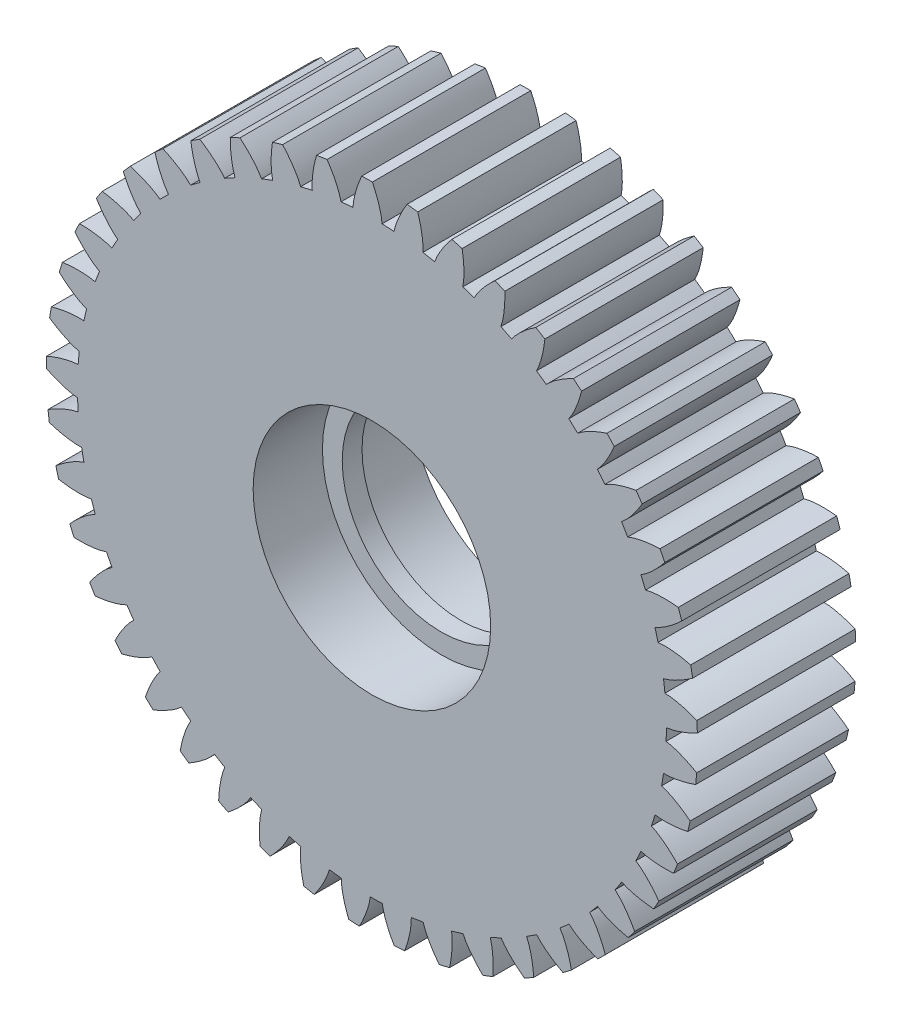
from build123d import *

# Parameters (mm, degrees)
SKETCH1_R           = 16.45
BOSS_EXTRUDE1_DEPTH = 4
CUT_EXTRUDE1_DEPTH  = 24.605190107
CIRPATTERN2_COUNT   = 45
SKETCH3_R           = 6
CUT_EXTRUDE2_DEPTH  = 3.5
SKETCH4_R           = 5
CUT_EXTRUDE3_DEPTH  = 24.694965986


with BuildPart() as part:
    # Sketch1 → Boss-Extrude1 (new, symmetric)
    with BuildSketch(Plane.XY):
        Circle(SKETCH1_R)
    extrude(amount=BOSS_EXTRUDE1_DEPTH, both=True)

    # Sketch2 → Cut-Extrude1 (cut, symmetric)
    with BuildSketch(Plane.XY):
        with BuildLine():
            ThreePointArc((14.874999148, 0.005033376), (14.874999787, 0.002516688), (14.875, 0))
            ThreePointArc((14.875, 0), (14.872024444, -0.297512903), (14.863098968, -0.594906779))
            ThreePointArc((14.863098968, -0.594906779), (14.862998103, -0.597421445), (14.862896813, -0.599936094))
            add(Edge.make_bspline(
                [(14.862896813, -0.599936094), (14.870907538, -0.601068862), (14.895736459, -0.604763281), (14.937417723, -0.611844995), (15.004055833, -0.624994787), (15.087462709, -0.644243252), (15.178684548, -0.66823395), (15.277399962, -0.697384976), (15.375371502, -0.729155348), (15.47258681, -0.76333931), (15.56893702, -0.799632819), (15.685024278, -0.846230906), (15.823329346, -0.905762447), (15.98357076, -0.980633134), (16.156460134, -1.068169193), (16.285563182, -1.138667745), (16.368038757, -1.185527975), (16.405637502, -1.207293734)],
                knots=[0.019933852, 0.019933852, 0.019933852, 0.019933852, 0.019933852, 0.02853182, 0.04661014, 0.064854849, 0.092110525, 0.119476176, 0.146842496, 0.174208854, 0.201574956, 0.228941013, 0.256307345, 0.307035032, 0.361767352, 0.416499661, 0.46276345, 0.46276345, 0.46276345, 0.46276345, 0.46276345], degree=4))
            ThreePointArc((16.405637502, -1.207293734), (16.438905634, -0.604054259), (16.45, 0))
            ThreePointArc((16.45, 0), (16.447698848, 0.275141053), (16.440796037, 0.550205128))
            add(Edge.make_bspline(
                [(14.874999148, 0.005033376), (14.883048768, 0.005844859), (14.908005577, 0.008543321), (14.949936717, 0.01395238), (15.017047422, 0.024426544), (15.101157385, 0.040323856), (15.193265718, 0.060647058), (15.293068011, 0.085826764), (15.392231782, 0.113653469), (15.490736455, 0.143922078), (15.588461091, 0.176333146), (15.706319103, 0.218251188), (15.846894406, 0.272203764), (16.010001974, 0.340605897), (16.186253918, 0.421157429), (16.318073175, 0.486436265), (16.402356879, 0.529960497), (16.440796037, 0.550205128)],
                knots=[0.019933852, 0.019933852, 0.019933852, 0.019933852, 0.019933852, 0.02853182, 0.04661014, 0.064854849, 0.092110525, 0.119476176, 0.146842496, 0.174208854, 0.201574956, 0.228941013, 0.256307345, 0.307035032, 0.361767352, 0.416499661, 0.46276345, 0.46276345, 0.46276345, 0.46276345, 0.46276345], degree=4))
        make_face()
    cut_extrude1 = extrude(amount=CUT_EXTRUDE1_DEPTH, both=True, mode=Mode.SUBTRACT)

    # CirPattern2: Cut-Extrude1 ×45 about axis
    cirpattern2_axis = Axis((0, 0, 4), (0, 0, -1))
    for i in range(1, CIRPATTERN2_COUNT):
        add(cut_extrude1.rotate(cirpattern2_axis, i * 360 / CIRPATTERN2_COUNT), mode=Mode.SUBTRACT)

    # Sketch3 → Cut-Extrude2 (cut)
    with BuildSketch(Plane.XY.offset(4)):
        Circle(SKETCH3_R)
    cut_extrude2 = extrude(amount=-CUT_EXTRUDE2_DEPTH, mode=Mode.SUBTRACT)

    # Sketch4 → Cut-Extrude3 (cut, through all)
    with BuildSketch(Plane.XY.offset(0.5)):
        Circle(SKETCH4_R)
    extrude(amount=-CUT_EXTRUDE3_DEPTH, mode=Mode.SUBTRACT)

    # Mirror1: Cut-Extrude2 across plane
    add(cut_extrude2.mirror(Plane.XY), mode=Mode.SUBTRACT)


solid = part.part
